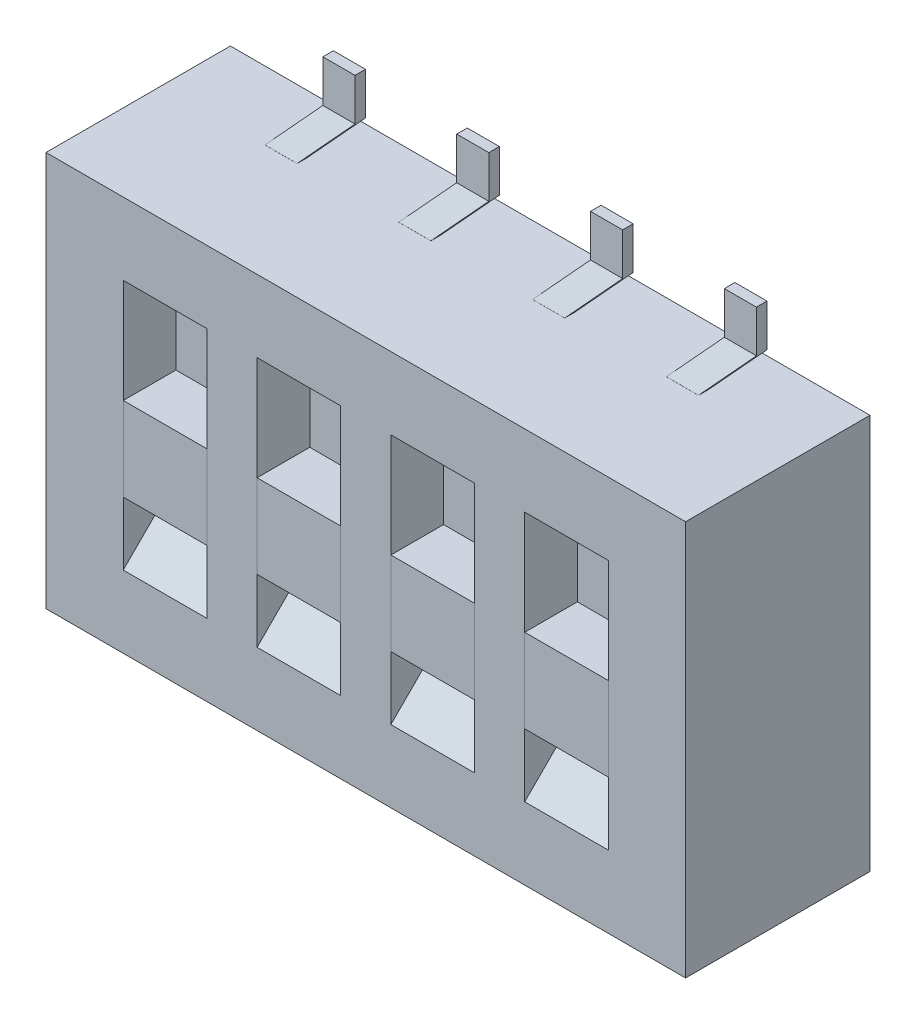
from build123d import *

# Parameters (mm, degrees)
SKETCH_1_W                         = 12.14
SKETCH_1_H                         = 7.5
EXTRUDE_1_DEPTH                    = 3.5
SKETCH_2_W                         = 1.5875
SKETCH_2_H                         = 2.7625
CUT_EXTRUDE_1_DEPTH                = 1
CHAMFER_1_SIZE                     = 1
SKETCH_3_W                         = 1.5875
SKETCH_3_H                         = 1.5875
EXTRUDE_3_DEPTH                    = 1
PATTERN_LINEAR_1_COUNT             = 4
PATTERN_LINEAR_1_PITCH             = 2.54
CHAMFER_1_OF_PATTERN_LINEAR_1_SIZE = 1
PATTERN_LINEAR_2_COUNT             = 4
PATTERN_LINEAR_2_PITCH             = 2.54
SKETCH_4_W                         = 0.61
SKETCH_4_H                         = 0.8
EXTRUDE_4_DEPTH                    = 0.2
SKETCH_5_W                         = 0.61
SKETCH_5_H                         = 0.2
EXTRUDE_5_DEPTH                    = 0.001
PATTERN_LINEAR_3_COUNT             = 4
PATTERN_LINEAR_3_PITCH             = 2.54


with BuildPart() as part:
    # Эскиз1 → Бобышка-Вытянуть1 (new body)
    with BuildSketch(Plane.XY):
        Rectangle(SKETCH_1_W, SKETCH_1_H)
    extrude(amount=EXTRUDE_1_DEPTH)

    # Эскиз2 → Вырез-Вытянуть1 (cut)
    with BuildSketch(Plane.XY.offset(3.5)):
        with Locations((-3.81, 0)):
            Rectangle(SKETCH_2_W, SKETCH_2_H)
    cut_extrude_1 = extrude(amount=-CUT_EXTRUDE_1_DEPTH, mode=Mode.SUBTRACT)

    # Фаска1
    chamfer_1_edges = [part.edges().sort_by_distance(p)[0] for p in [
        (-3.81, 1.38125, 3.5),
        (-3.81, -1.38125, 3.5),
    ]]
    chamfer(chamfer_1_edges, length=CHAMFER_1_SIZE - 0.0001)  # a hair under: the kernel refuses the full size

    # Линейный массив1: Вырез-Вытянуть1 ×4
    with Locations(*[(i * PATTERN_LINEAR_1_PITCH, 0, 0) for i in range(1, PATTERN_LINEAR_1_COUNT)]):
        add(cut_extrude_1, mode=Mode.SUBTRACT)

    # Фаска1 of Линейный массив1
    chamfer_1_of_pattern_linear_1_edges = [part.edges().sort_by_distance(p)[0] for p in [
        (-1.27, 1.38125, 3.5),
        (-1.27, -1.38125, 3.5),
        (1.27, 1.38125, 3.5),
        (1.27, -1.38125, 3.5),
        (3.81, 1.38125, 3.5),
        (3.81, -1.38125, 3.5),
    ]]
    chamfer(chamfer_1_of_pattern_linear_1_edges, length=CHAMFER_1_OF_PATTERN_LINEAR_1_SIZE - 0.0001)  # a hair under: the kernel refuses the full size


with BuildPart() as body_2:
    # Эскиз3 → Бобышка-Вытянуть3 (new body)
    with BuildSketch(Plane.XY.offset(2.5)):
        with Locations((-3.81, -0.3875)):
            Rectangle(SKETCH_3_W, SKETCH_3_H)
    extrude_3 = extrude(amount=EXTRUDE_3_DEPTH)


with BuildPart() as pattern_linear_2_1:
    # Линейный массив2: Бобышка-Вытянуть3 ×4
    with Locations(*[(i * PATTERN_LINEAR_2_PITCH, 0, 0) for i in range(1, PATTERN_LINEAR_2_COUNT)]):
        add(extrude_3)


with BuildPart() as body_6:
    # Эскиз4 → Бобышка-Вытянуть4 (new body)
    with BuildSketch(Plane.XY):
        with Locations((-3.81, -4.25)):
            Rectangle(SKETCH_4_W, SKETCH_4_H)
    extrude(amount=EXTRUDE_4_DEPTH)


with BuildPart() as body_7:
    # Эскиз5 → Бобышка-Вытянуть5 (new body)
    with BuildSketch(Plane.XZ.offset(3.75)):
        with Locations((-3.81, 1.2)):
            Rectangle(SKETCH_5_W, SKETCH_5_H)
    extrude(amount=EXTRUDE_5_DEPTH)


    add(body_6.part)  # loft_1 joins it to this body
    # loft from a face of the part (loft_1)
    loft([body_7.faces().sort_by_distance((-3.81, -3.751, 1.2))[0], body_7.faces().sort_by_distance((-3.81, -3.85, 0.1))[0]])


with BuildPart() as pattern_linear_3_1:
    # Линейный массив3: pattern copy
    add(body_7.part.moved(Location(Vector(1, 0, 0) * (1 * PATTERN_LINEAR_3_PITCH))))


with BuildPart() as pattern_linear_3_2:
    # Линейный массив3: pattern copy
    add(body_7.part.moved(Location(Vector(1, 0, 0) * (2 * PATTERN_LINEAR_3_PITCH))))


with BuildPart() as pattern_linear_3_3:
    # Линейный массив3: pattern copy
    add(body_7.part.moved(Location(Vector(1, 0, 0) * (3 * PATTERN_LINEAR_3_PITCH))))


with BuildPart() as body_10:
    # Зеркальное отражение4: mirrored copy
    add(pattern_linear_3_1.part.mirror(Plane.ZX))


with BuildPart() as body_11:
    # Mirror 4 2: mirrored copy
    add(pattern_linear_3_2.part.mirror(Plane.ZX))


with BuildPart() as body_12:
    # Mirror 4 3: mirrored copy
    add(pattern_linear_3_3.part.mirror(Plane.ZX))


with BuildPart() as body_13:
    # Mirror 4 4: mirrored copy
    add(body_7.part.mirror(Plane.ZX))


solid = Compound([part.part, body_2.part, pattern_linear_2_1.part, body_7.part, pattern_linear_3_1.part, pattern_linear_3_2.part, pattern_linear_3_3.part, body_10.part, body_11.part, body_12.part, body_13.part])
